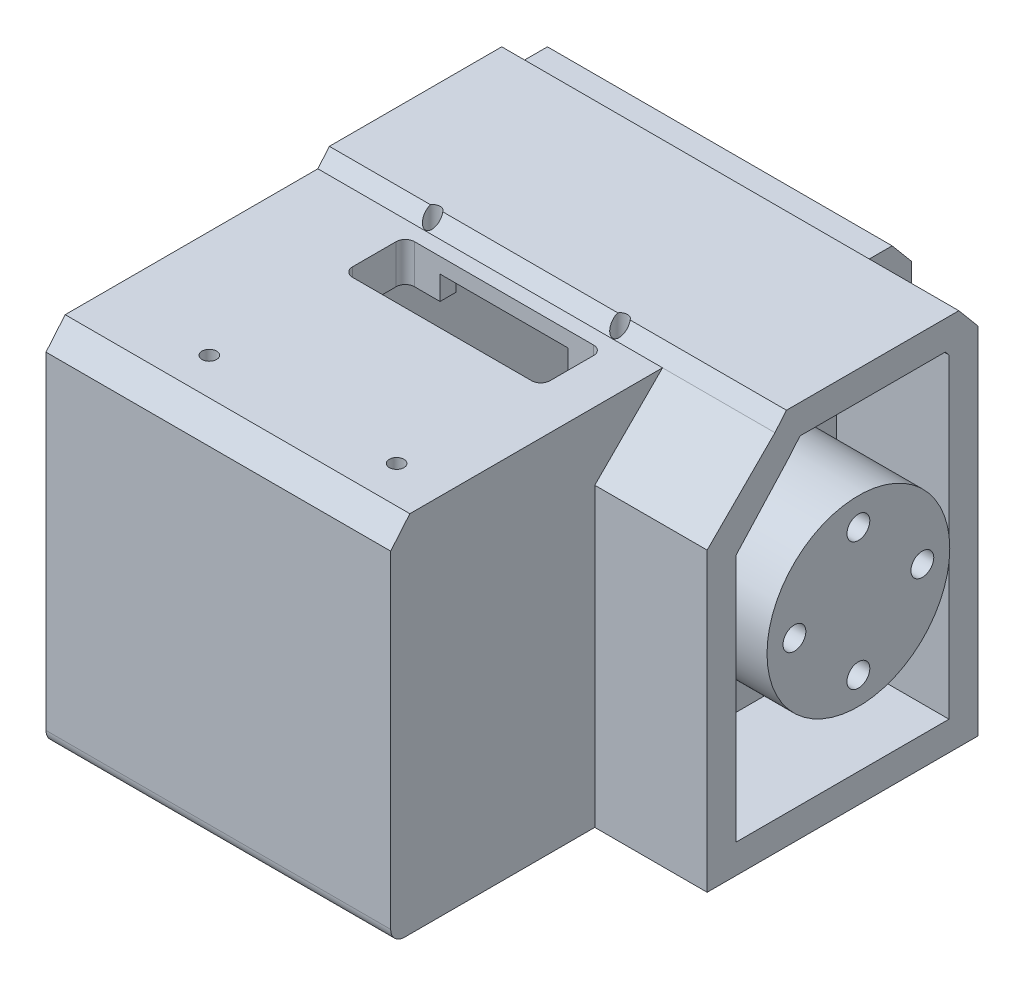
from build123d import *
from OCP.BRepFilletAPI import BRepFilletAPI_MakeChamfer
from build123d.topology import SkipClean

# Parameters (mm, degrees)
SKETCH1_W            = 51.97
SKETCH1_H            = 43.25
BOSS_EXTRUDE1_DEPTH  = 3.175
SKETCH2_W            = 51.97
SKETCH2_H            = 43.25
SKETCH2_W_2          = 45.62
SKETCH2_H_2          = 36.9
BOSS_EXTRUDE2_DEPTH  = 25.12
SKETCH5_R            = 0.8
BOSS_EXTRUDE4_DEPTH  = 2.6
CUT_EXTRUDE2_DEPTH   = 56.514258304
FILLET4_R            = 1
SKETCH7_W            = 28.295
SKETCH7_H            = 29.75
CUT_EXTRUDE3_DEPTH   = 1.5
CHAMFER3_SIZE2       = 1.5
CHAMFER3_SIZE        = 1.258649447
CHAMFER4_SIZE        = 2.5
CHAMFER4_SIZE2       = 2.097749078
CHAMFER5_SIZE        = 2.5
CHAMFER5_SIZE2       = 2.097749078
BOSS_EXTRUDE5_START  = 1.9
SKETCH8_R            = 0.8
BOSS_EXTRUDE5_DEPTH  = 1.9
SKETCH9_R            = 0.8
CUT_EXTRUDE4_DEPTH   = 56.514258304
SKETCH10_W           = 28.295
SKETCH10_H           = 32.92
CUT_EXTRUDE5_DEPTH   = 1.9
CHAMFER6_SIZE2       = 1.594289299
CHAMFER6_SIZE        = 1.9
CUT_EXTRUDE6_DEPTH   = 56.514258304
SKETCH12_R           = 0.8
CUT_EXTRUDE7_DEPTH   = 56.514258304
SKETCH13_W           = 28.295
SKETCH13_H           = 33.009615074
CUT_EXTRUDE8_DEPTH   = 1.9
BOSS_EXTRUDE6_DEPTH  = 3.175
SKETCH15_R           = 10
SKETCH15_R_2         = 1.25
BOSS_EXTRUDE7_DEPTH  = 12.7
CUT_EXTRUDE9_START   = -3.175
SKETCH16_R           = 1.25
CUT_EXTRUDE9_DEPTH   = 3.175
BOSS_EXTRUDE8_DEPTH  = 12.3
BOSS_EXTRUDE9_DEPTH  = 6.25
SKETCH19_W           = 5
SKETCH19_H           = 38.85
BOSS_EXTRUDE10_DEPTH = 37.72
CHAMFER7_SIZE        = 2.5
CHAMFER7_SIZE2       = 2.097749078
FILLET5_R            = 1.5
BOSS_EXTRUDE11_DEPTH = 1
CHAMFER8_SIZE        = 1
CHAMFER8_SIZE_2      = 0.839099631
CUT_EXTRUDE10_DEPTH  = 67.093795095
CHAMFER9_SIZE        = 6.35


with BuildPart() as part:
    # Sketch1 → Boss-Extrude1 (new body)
    with BuildSketch(Plane(origin=(0, 0, 0), x_dir=(0, 0, -1), z_dir=(1, 0, 0))):
        Rectangle(SKETCH1_W, SKETCH1_H)
    extrude(amount=BOSS_EXTRUDE1_DEPTH)

    # Sketch2 → Boss-Extrude2 (add)
    with BuildSketch(Plane(origin=(3.175, 0, 0), x_dir=(0, 0, -1), z_dir=(1, 0, 0))):
        Rectangle(SKETCH2_W, SKETCH2_H)
        Rectangle(SKETCH2_W_2, SKETCH2_H_2, mode=Mode.SUBTRACT)
    extrude(amount=BOSS_EXTRUDE2_DEPTH)

    # Sketch5 → Boss-Extrude4 (add)
    with BuildSketch(Plane.XZ.offset(-18.45)):
        with BuildLine():
            Line((6.028516065, -6.938519702), (3.175, -6.938519702))
            Line((3.175, -6.938519702), (3.175, 22.81))
            Line((3.175, 22.81), (28.295, 22.81))
            Line((28.295, 22.81), (28.295, -6.938516819))
            Line((28.295, -6.938516819), (25.441479797, -6.938516819))
            ThreePointArc((25.441479797, -6.938516819), (24.224057136, -5.304544733), (22.734996312, -3.913616778))
            Line((22.734996312, -3.913616778), (22.734999457, -2.150000068))
            Line((22.734999457, -2.150000068), (26.535, -2.149999996))
            Line((26.535, -2.149999996), (26.535, 4.625))
            Line((26.535, 4.625), (25.038042913, 4.625))
            Line((25.038042913, 4.625), (25.177286694, 4.847898808))
            Line((25.177286694, 4.847898808), (25.177286694, 15.803085322))
            ThreePointArc((25.177286694, 15.803085322), (24.825814832, 16.651613459), (23.977286696, 17.003085322))
            Line((23.977286696, 17.003085322), (7.492713306, 17.003085322))
            ThreePointArc((7.492713306, 17.003085322), (6.64418517, 16.651613461), (6.292713306, 15.803085325))
            Line((6.292713306, 15.803085325), (6.292713306, 4.847898808))
            Line((6.292713306, 4.847898808), (6.431957087, 4.625))
            Line((6.431957087, 4.625), (4.935, 4.625))
            Line((4.935, 4.625), (4.935, -2.149999996))
            Line((4.935, -2.149999996), (8.73500054, -2.150000068))
            Line((8.73500054, -2.150000068), (8.735003672, -3.913614235))
            ThreePointArc((8.735003672, -3.913614235), (7.245940337, -5.304544533), (6.028516065, -6.938519702))
        make_face()
        with Locations(Location((5.485, -4.6, 0), (0, 0, 270))):
            Circle(SKETCH5_R, mode=Mode.SUBTRACT)
        with Locations(Location((5.485, 19.85, 0), (0, 0, 270))):
            Circle(SKETCH5_R, mode=Mode.SUBTRACT)
        with Locations(Location((25.985, 19.85, 0), (0, 0, 270))):
            Circle(SKETCH5_R, mode=Mode.SUBTRACT)
        with Locations(Location((25.985, -4.6, 0), (0, 0, 270))):
            Circle(SKETCH5_R, mode=Mode.SUBTRACT)
    extrude(amount=BOSS_EXTRUDE4_DEPTH)

    # Sketch6 → Cut-Extrude2 (cut, through all)
    with BuildSketch(Plane.XZ.offset(-18.45)):
        Polygon((6.431957087, 4.625), (4.935, 4.625), (4.935, -2.149999996), (8.73500054, -2.149999996), (22.734999457, -2.149999996), (26.535, -2.149999996), (26.535, 4.625), (25.038042913, 4.625), align=None)
    extrude(amount=-CUT_EXTRUDE2_DEPTH, mode=Mode.SUBTRACT)

    # Fillet4
    fillet4_edges = [part.edges().sort_by_distance(p)[0] for p in [
        (4.935, 20.0375, -2.149999996),
        (4.935, 18.7375, 4.625),
        (26.535, 18.7375, 4.625),
        (26.535, 20.0375, -2.149999996),
    ]]
    fillet(fillet4_edges, radius=FILLET4_R)

    # Sketch7 → Cut-Extrude3 (cut)
    with BuildSketch(Plane(origin=(0, 21.625, 0), x_dir=(1, 0, 0), z_dir=(0, 1, 0))):
        with Locations((14.1475, -11.11)):
            Rectangle(SKETCH7_W, SKETCH7_H)
    extrude(amount=-CUT_EXTRUDE3_DEPTH, mode=Mode.SUBTRACT)

    # Chamfer3
    chamfer3_edges = [part.edges().sort_by_distance(p)[0] for p in [
        (14.1475, 21.625, -3.765),
    ]]
    chamfer3_side = [part.faces().sort_by_distance(p)[0] for p in [
        (14.1475, 21.625, -3.790172989),
    ]]
    chamfer(chamfer3_edges, length=CHAMFER3_SIZE - 0.0001, length2=CHAMFER3_SIZE2 - 0.0001, reference=chamfer3_side[0])  # a hair under: the kernel refuses the full size

    # Chamfer4
    chamfer4_edges = [part.edges().sort_by_distance(p)[0] for p in [
        (14.1475, 20.125, 25.985),
    ]]
    chamfer4_side = [part.faces().sort_by_distance(p)[0] for p in [
        (14.1475, -0.75, 25.985),
    ]]
    chamfer(chamfer4_edges, length=CHAMFER4_SIZE, length2=CHAMFER4_SIZE2, reference=chamfer4_side[0])

    # Chamfer5
    chamfer5_edges = [part.edges().sort_by_distance(p)[0] for p in [
        (14.1475, 21.625, -25.985),
    ]]
    chamfer5_side = [part.faces().sort_by_distance(p)[0] for p in [
        (14.1475, 0, -25.985),
    ]]
    chamfer(chamfer5_edges, length=CHAMFER5_SIZE, length2=CHAMFER5_SIZE2, reference=chamfer5_side[0])

    # Sketch8 → Boss-Extrude5 (add)
    # profile 1 of 2: a face of its own
    with BuildSketch(Plane(origin=(0, -18.45, 0), x_dir=(1, 0, 0), z_dir=(0, 1, 0)).offset(BOSS_EXTRUDE5_START)):
        with BuildLine():
            Line((8.535, -21.20621931), (8.535, 2.277382622))
            ThreePointArc((8.535, 2.277382622), (8.678721463, 2.846834684), (9.07545942, 3.279882607))
            ThreePointArc((9.07545942, 3.279882607), (7.174247423, 4.924433894), (5.668201654, 6.937139072))
            ThreePointArc((5.668201654, 6.937139072), (5.667144466, 6.93892423), (5.666087595, 6.940709575))
            Line((5.666087595, 6.940709575), (3.175, 6.940709575))
            Line((3.175, 6.940709575), (3.175, -22.81))
            Line((3.175, -22.81), (8.815822102, -22.81))
            Line((8.815822102, -22.81), (8.815822102, -21.97765433))
            ThreePointArc((8.815822102, -21.97765433), (8.607388924, -21.616698616), (8.535, -21.20621931))
        make_face()
        with Locations(Location((5.485, -16.1, 0), (0, 0, 90))):
            Circle(SKETCH8_R, mode=Mode.SUBTRACT)
        with Locations(Location((5.485, 4.6, 0), (0, 0, 90))):
            Circle(SKETCH8_R, mode=Mode.SUBTRACT)
    # profile 2 of 2: a face of its own
    with BuildSketch(Plane(origin=(0, -18.45, 0), x_dir=(1, 0, 0), z_dir=(0, 1, 0)).offset(BOSS_EXTRUDE5_START)):
        with BuildLine():
            Line((22.654192711, -21.977637856), (22.654192711, -22.81))
            Line((22.654192711, -22.81), (28.295, -22.81))
            Line((28.295, -22.81), (28.295, 6.939158699))
            Line((28.295, 6.939158699), (25.802994691, 6.939158699))
            ThreePointArc((25.802994691, 6.939158699), (24.296552833, 4.925292532), (22.394540839, 3.279882437))
            ThreePointArc((22.394540839, 3.279882437), (22.791278611, 2.846834547), (22.935, 2.27738262))
            Line((22.935, 2.27738262), (22.935000265, -21.206220073))
            ThreePointArc((22.935000265, -21.206220073), (22.862615212, -21.616688792), (22.654192711, -21.977637856))
        make_face()
        with Locations(Location((25.985, -16.1, 0), (0, 0, 90))):
            Circle(SKETCH8_R, mode=Mode.SUBTRACT)
        with Locations(Location((25.985, 4.6, 0), (0, 0, 90))):
            Circle(SKETCH8_R, mode=Mode.SUBTRACT)
    extrude(amount=-BOSS_EXTRUDE5_DEPTH)

    # Sketch9 → Cut-Extrude4 (cut, through all)
    with SkipClean():  # the faces are left unmerged after this step: merging them gives an invalid solid
        with BuildSketch(Plane.XZ.offset(-18.45)):
            with Locations(Location((5.485, -4.6, 0), (0, 0, 211.975852771))):
                Circle(SKETCH9_R)
            with Locations(Location((25.985, -4.6, 0), (0, 0, 211.975852771))):
                Circle(SKETCH9_R)
            with Locations(Location((25.985, 19.85, 0), (0, 0, 90))):
                Circle(SKETCH9_R)
            with Locations(Location((5.485, 19.85, 0), (0, 0, 90))):
                Circle(SKETCH9_R)
        extrude(amount=-CUT_EXTRUDE4_DEPTH, mode=Mode.SUBTRACT)
    add(part.part.scale(1), mode=Mode.REPLACE)  # the faces are merged on a copy

    # Sketch10 → Cut-Extrude5 (cut)
    with BuildSketch(Plane.XZ.offset(21.625)):
        with Locations((14.1475, 9.525)):
            Rectangle(SKETCH10_W, SKETCH10_H)
    extrude(amount=-CUT_EXTRUDE5_DEPTH, mode=Mode.SUBTRACT)

    # Chamfer6
    chamfer6_edges = [part.edges().sort_by_distance(p)[0] for p in [
        (14.1475, -19.725, -6.935),
    ]]
    chamfer6_side = [part.faces().sort_by_distance(p)[0] for p in [
        (14.1475, -19.756885786, -6.935),
    ]]
    chamfer(chamfer6_edges, length=CHAMFER6_SIZE - 0.0001, length2=CHAMFER6_SIZE2 - 0.0001, reference=chamfer6_side[0])  # a hair under: the kernel refuses the full size

    # Sketch11 → Cut-Extrude6 (cut, through all)
    with BuildSketch(Plane(origin=(0, -18.45, 0), x_dir=(1, 0, 0), z_dir=(0, 1, 0))):
        with BuildLine():
            Line((3.175, 22.81), (3.175, 6.940709575))
            Line((3.175, 6.940709575), (5.666087595, 6.940709575))
            ThreePointArc((5.666087595, 6.940709575), (7.172833315, 4.925952029), (9.07545942, 3.279882607))
            ThreePointArc((9.07545942, 3.279882607), (15.735000094, 0.521410441), (22.394540839, 3.279882437))
            ThreePointArc((22.394540839, 3.279882437), (24.296552833, 4.925292532), (25.802994691, 6.939158699))
            Line((25.802994691, 6.939158699), (28.295, 6.939158699))
            Line((28.295, 6.939158699), (28.295, 22.81))
            Line((28.295, 22.81), (3.175, 22.81))
        make_face()
    extrude(amount=-CUT_EXTRUDE6_DEPTH, mode=Mode.SUBTRACT)

    # Sketch12 → Cut-Extrude7 (cut, through all)
    with BuildSketch(Plane(origin=(0, -18.45, 0), x_dir=(1, 0, 0), z_dir=(0, 1, 0))):
        with Locations(Location((25.985, 4.6, 0), (0, 0, 148.024147229))):
            Circle(SKETCH12_R)
        with Locations(Location((25.985, -16.1, 0), (0, 0, 90))):
            Circle(SKETCH12_R)
        with Locations(Location((5.485, -16.1, 0), (0, 0, 90))):
            Circle(SKETCH12_R)
        with Locations(Location((5.485, 4.6, 0), (0, 0, 148.024147229))):
            Circle(SKETCH12_R)
    extrude(amount=-CUT_EXTRUDE7_DEPTH, mode=Mode.SUBTRACT)

    # Sketch13 → Cut-Extrude8 (cut)
    with BuildSketch(Plane.XZ.offset(21.625)):
        with Locations((14.1475, -9.480192463)):
            Rectangle(SKETCH13_W, SKETCH13_H)
    extrude(amount=-CUT_EXTRUDE8_DEPTH, mode=Mode.SUBTRACT)

    # Sketch14 → Boss-Extrude6 (add)
    with BuildSketch(Plane(origin=(28.295, 0, 0), x_dir=(0, 0, -1), z_dir=(1, 0, 0))):
        Polygon((25.985, -19.725), (25.985, 19.125), (23.887250922, 21.625), (5.023649447, 21.625), (3.765, 20.125), (-23.887250922, 20.125), (-25.985, 17.625), (-25.985, -19.725), align=None)
    extrude(amount=BOSS_EXTRUDE6_DEPTH)

    # Sketch15 → Boss-Extrude7 (add)
    with BuildSketch(Plane(origin=(31.47, 0, 0), x_dir=(0, 0, -1), z_dir=(1, 0, 0))):
        with Locations((12.495, 0)):
            Circle(SKETCH15_R)
        with Locations((12.495, 7)):
            Circle(SKETCH15_R_2, mode=Mode.SUBTRACT)
        with Locations((19.495, 0)):
            Circle(SKETCH15_R_2, mode=Mode.SUBTRACT)
        with Locations((5.495, 0)):
            Circle(SKETCH15_R_2, mode=Mode.SUBTRACT)
        with Locations((12.495, -7)):
            Circle(SKETCH15_R_2, mode=Mode.SUBTRACT)
    extrude(amount=BOSS_EXTRUDE7_DEPTH)

    # Sketch16 → Cut-Extrude9 (cut)
    with BuildSketch(Plane(origin=(31.47, 0, 0), x_dir=(0, 0, -1), z_dir=(1, 0, 0)).offset(CUT_EXTRUDE9_START)):
        with Locations((19.495, 0)):
            Circle(SKETCH16_R)
        with Locations((12.495, -7)):
            Circle(SKETCH16_R)
        with Locations((5.495, 0)):
            Circle(SKETCH16_R)
        with Locations((12.495, 7)):
            Circle(SKETCH16_R)
    extrude(amount=CUT_EXTRUDE9_DEPTH, mode=Mode.SUBTRACT)

    # Sketch17 → Boss-Extrude8 (add)
    with BuildSketch(Plane(origin=(31.47, 0, 0), x_dir=(0, 0, -1), z_dir=(1, 0, 0))):
        Polygon((25.985, -19.725), (25.985, 19.125), (23.887250922, 21.625), (5.023649447, 21.625), (3.765, 20.125), (-3.652691279, 12.707308721), (-3.652691279, 11.672370782), (-3.652691279, -16.55), (-3.652691279, -19.725), align=None)
        Polygon((-0.477691279, -16.55), (22.81, -16.55), (22.81, 17.969394506), (22.406724107, 18.45), (6.504176261, 18.45), (5.245526815, 16.95), (-0.477691279, 10.665513175), align=None, mode=Mode.SUBTRACT)
    extrude(amount=BOSS_EXTRUDE8_DEPTH)

    # Sketch18 → Boss-Extrude9 (add)
    with BuildSketch(Plane.ZY):
        Polygon((-25.985, 19.125), (-25.985, -19.725), (25.985, -19.725), (25.985, 17.625), (23.887250922, 20.125), (-3.765, 20.125), (-5.023649447, 21.625), (-23.887250922, 21.625), align=None)
    extrude(amount=BOSS_EXTRUDE9_DEPTH)

    # Sketch19 → Boss-Extrude10 (add)
    with BuildSketch(Plane.ZY.offset(6.25)):
        with Locations((-28.485, -0.3)):
            Rectangle(SKETCH19_W, SKETCH19_H)
    extrude(amount=-BOSS_EXTRUDE10_DEPTH)

    # Chamfer7
    chamfer7_edges = [part.edges().sort_by_distance(p)[0] for p in [
        (12.61, 19.125, -30.985),
    ]]
    chamfer7_side = [part.faces().sort_by_distance(p)[0] for p in [
        (12.61, -0.3, -30.985),
    ]]
    chamfer(chamfer7_edges, length=CHAMFER7_SIZE, length2=CHAMFER7_SIZE2, reference=chamfer7_side[0])

    # Fillet5
    fillet5_edges = [part.edges().sort_by_distance(p)[0] for p in [
        (12.61, -19.725, 25.985),
        (12.61, -19.725, -30.985),
    ]]
    fillet(fillet5_edges, radius=FILLET5_R)

    # Sketch20 → Boss-Extrude11 (add)
    with BuildSketch(Plane.ZY.offset(6.25)):
        with BuildLine():
            Line((-25.985, 14.125), (-25.985, -12.225))
            ThreePointArc((-25.985, -12.225), (-25.252766953, -13.992766953), (-23.485, -14.725))
            Line((-23.485, -14.725), (18.485, -14.725))
            ThreePointArc((18.485, -14.725), (20.252766953, -13.992766953), (20.985, -12.225))
            Line((20.985, -12.225), (20.985, 12.625))
            ThreePointArc((20.985, 12.625), (20.252766953, 14.392766953), (18.485, 15.125))
            Line((18.485, 15.125), (-6.096538291, 15.125))
            Line((-6.096538291, 15.125), (-7.355187738, 16.625))
            Line((-7.355187738, 16.625), (-21.555712631, 16.625))
            Line((-21.555712631, 16.625), (-23.653461709, 14.125))
            Line((-23.653461709, 14.125), (-25.985, 14.125))
        make_face()
    extrude(amount=BOSS_EXTRUDE11_DEPTH)

    # Chamfer8
    chamfer8_edges_1 = [part.edges().sort_by_distance(p)[0] for p in [
        (-7.25, 0.95, -25.985),
    ]]
    chamfer8_side_1 = [part.faces().sort_by_distance(p)[0] for p in [
        (-7.233218007, 0.95, -25.985),
    ]]
    chamfer8_edges_2 = [part.edges().sort_by_distance(p)[0] for p in [
        (-7.25, 14.125, -24.819230855),
    ]]
    chamfer8_side_2 = [part.faces().sort_by_distance(p)[0] for p in [
        (-7.233218007, 14.125, -24.819230855),
    ]]
    chamfer8_edges_3 = [part.edges().sort_by_distance(p)[0] for p in [
        (-7.25, 15.375, -22.60458717),
    ]]
    chamfer8_side_3 = [part.faces().sort_by_distance(p)[0] for p in [
        (-7.233218007, 15.375, -22.60458717),
    ]]
    chamfer8_edges_4 = [part.edges().sort_by_distance(p)[0] for p in [
        (-7.25, 16.625, -14.455450184),
    ]]
    chamfer8_side_4 = [part.faces().sort_by_distance(p)[0] for p in [
        (-7.233218007, 16.625, -14.455450184),
    ]]
    chamfer8_edges_5 = [part.edges().sort_by_distance(p)[0] for p in [
        (-7.25, 15.875, -6.725863014),
    ]]
    chamfer8_side_5 = [part.faces().sort_by_distance(p)[0] for p in [
        (-7.233218007, 15.875, -6.725863014),
    ]]
    chamfer8_edges_6 = [part.edges().sort_by_distance(p)[0] for p in [
        (-7.25, 15.125, 6.194230855),
    ]]
    chamfer8_side_6 = [part.faces().sort_by_distance(p)[0] for p in [
        (-7.233218007, 15.125, 6.194230855),
    ]]
    chamfer8_edges_7 = [part.edges().sort_by_distance(p)[0] for p in [
        (-7.25, 14.392766953, 20.252766953),
    ]]
    chamfer8_side_7 = [part.faces().sort_by_distance(p)[0] for p in [
        (-7.233218007, 14.392766953, 20.252766953),
    ]]
    chamfer8_edges_8 = [part.edges().sort_by_distance(p)[0] for p in [
        (-7.25, 0.2, 20.985),
    ]]
    chamfer8_side_8 = [part.faces().sort_by_distance(p)[0] for p in [
        (-7.233218007, 0.2, 20.985),
    ]]
    chamfer8_edges_9 = [part.edges().sort_by_distance(p)[0] for p in [
        (-7.25, -13.992766953, 20.252766953),
    ]]
    chamfer8_side_9 = [part.faces().sort_by_distance(p)[0] for p in [
        (-7.233218007, -13.992766953, 20.252766953),
    ]]
    chamfer8_edges_10 = [part.edges().sort_by_distance(p)[0] for p in [
        (-7.25, -14.725, -2.5),
    ]]
    chamfer8_side_10 = [part.faces().sort_by_distance(p)[0] for p in [
        (-7.233218007, -14.725, -2.5),
    ]]
    chamfer8_edges_11 = [part.edges().sort_by_distance(p)[0] for p in [
        (-7.25, -13.992766953, -25.252766953),
    ]]
    chamfer8_side_11 = [part.faces().sort_by_distance(p)[0] for p in [
        (-7.233218007, -13.992766953, -25.252766953),
    ]]
    chamfer8 = BRepFilletAPI_MakeChamfer(part.part.solid().wrapped)
    for e in chamfer8_edges_1:
        chamfer8.Add(CHAMFER8_SIZE - 0.0001, CHAMFER8_SIZE_2 - 0.0001, e.wrapped, chamfer8_side_1[0].wrapped)
    for e in chamfer8_edges_2:
        chamfer8.Add(CHAMFER8_SIZE - 0.0001, CHAMFER8_SIZE_2 - 0.0001, e.wrapped, chamfer8_side_2[0].wrapped)
    for e in chamfer8_edges_3:
        chamfer8.Add(CHAMFER8_SIZE - 0.0001, CHAMFER8_SIZE_2 - 0.0001, e.wrapped, chamfer8_side_3[0].wrapped)
    for e in chamfer8_edges_4:
        chamfer8.Add(CHAMFER8_SIZE - 0.0001, CHAMFER8_SIZE_2 - 0.0001, e.wrapped, chamfer8_side_4[0].wrapped)
    for e in chamfer8_edges_5:
        chamfer8.Add(CHAMFER8_SIZE - 0.0001, CHAMFER8_SIZE_2 - 0.0001, e.wrapped, chamfer8_side_5[0].wrapped)
    for e in chamfer8_edges_6:
        chamfer8.Add(CHAMFER8_SIZE - 0.0001, CHAMFER8_SIZE_2 - 0.0001, e.wrapped, chamfer8_side_6[0].wrapped)
    for e in chamfer8_edges_7:
        chamfer8.Add(CHAMFER8_SIZE - 0.0001, CHAMFER8_SIZE_2 - 0.0001, e.wrapped, chamfer8_side_7[0].wrapped)
    for e in chamfer8_edges_8:
        chamfer8.Add(CHAMFER8_SIZE - 0.0001, CHAMFER8_SIZE_2 - 0.0001, e.wrapped, chamfer8_side_8[0].wrapped)
    for e in chamfer8_edges_9:
        chamfer8.Add(CHAMFER8_SIZE - 0.0001, CHAMFER8_SIZE_2 - 0.0001, e.wrapped, chamfer8_side_9[0].wrapped)
    for e in chamfer8_edges_10:
        chamfer8.Add(CHAMFER8_SIZE - 0.0001, CHAMFER8_SIZE_2 - 0.0001, e.wrapped, chamfer8_side_10[0].wrapped)
    for e in chamfer8_edges_11:
        chamfer8.Add(CHAMFER8_SIZE - 0.0001, CHAMFER8_SIZE_2 - 0.0001, e.wrapped, chamfer8_side_11[0].wrapped)
    add(Compound.cast(chamfer8.Shape()), mode=Mode.REPLACE)  # a hair under: the kernel refuses the full size

    # Sketch21 → Cut-Extrude10 (cut, through all)
    with BuildSketch(Plane(origin=(0, -16.55, 0), x_dir=(1, 0, 0), z_dir=(0, 1, 0))):
        with BuildLine():
            Line((3.175, -7.934645212), (28.295, -7.935420651))
            Line((28.295, -7.935420651), (28.295, 6.939158699))
            Line((28.295, 6.939158699), (25.802994691, 6.939158699))
            ThreePointArc((25.802994691, 6.939158699), (24.296552833, 4.925292532), (22.394540839, 3.279882437))
            ThreePointArc((22.394540839, 3.279882437), (15.735000094, 0.521410441), (9.07545942, 3.279882607))
            ThreePointArc((9.07545942, 3.279882607), (7.172833315, 4.925952029), (5.666087595, 6.940709575))
            Line((5.666087595, 6.940709575), (3.175, 6.940709575))
            Line((3.175, 6.940709575), (3.175, -7.934645212))
        make_face()
    extrude(amount=-CUT_EXTRUDE10_DEPTH, mode=Mode.SUBTRACT)

    # Chamfer9
    chamfer9_edges = [part.edges().sort_by_distance(p)[0] for p in [
        (15.735, -19.725, -22.81),
    ]]
    chamfer(chamfer9_edges, length=CHAMFER9_SIZE)


solid = part.part
